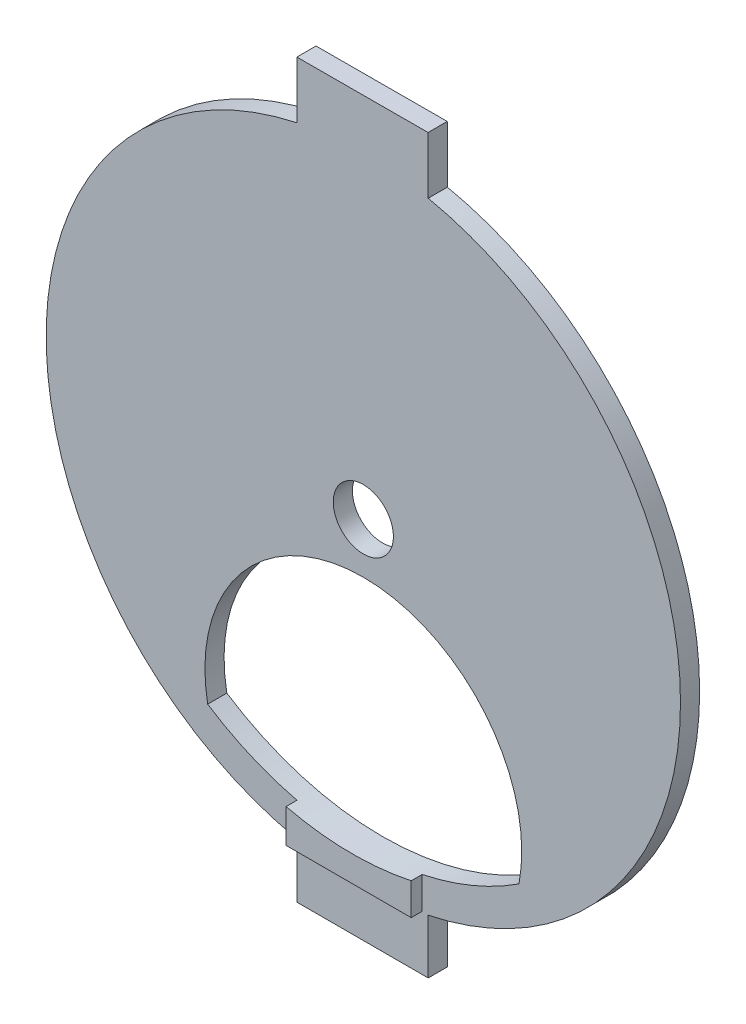
from build123d import *

# Parameters (mm, degrees)
BOSS_EXTRUDE1_DEPTH = 11.1252
SKETCH5_R           = 17.4625
CUT_EXTRUDE1_DEPTH  = 12.7
CUT_EXTRUDE4_DEPTH  = 12.7
BOSS_EXTRUDE2_START = 6.35
BOSS_EXTRUDE2_DEPTH = 6.35


with BuildPart() as part:
    # Sketch1 → Boss-Extrude1 (new body)
    with BuildSketch(Plane.XY):
        with BuildLine():
            Line((-38.598020157, 213.095995412), (-38.52088234, 180.075995412))
            ThreePointArc((-38.52088234, 180.075995412), (-184.15, 0), (-38.52088234, -180.075995412))
            Line((-38.52088234, -180.075995412), (-38.52088234, -211.825995412))
            Line((-38.52088234, -211.825995412), (37.67911766, -211.825995412))
            Line((37.67911766, -211.825995412), (37.67911766, -180.254005759))
            ThreePointArc((37.67911766, -180.254005759), (184.15, 0), (37.67911766, 180.254005759))
            Line((37.67911766, 180.254005759), (37.601979843, 213.274005759))
            Line((37.601979843, 213.274005759), (-38.598020157, 213.095995412))
        make_face()
    extrude(amount=BOSS_EXTRUDE1_DEPTH)

    # Sketch5 → Cut-Extrude1 (cut)
    with BuildSketch(Plane.XY.offset(11.1252)):
        Circle(SKETCH5_R)
    extrude(amount=-CUT_EXTRUDE1_DEPTH, mode=Mode.SUBTRACT)

    # Sketch6 → Cut-Extrude4 (cut)
    with BuildSketch(Plane.XY.offset(11.1252)):
        with BuildLine():
            ThreePointArc((90.375326038, -138.167689579), (0, -29.126312042), (-90.375326038, -138.167689579))
            ThreePointArc((-90.375326038, -138.167689579), (0, -165.1), (90.375326038, -138.167689579))
        make_face()
    extrude(amount=-CUT_EXTRUDE4_DEPTH, mode=Mode.SUBTRACT)

    # Sketch7 → Boss-Extrude2 (add)
    with BuildSketch(Plane.XY.offset(11.1252).offset(BOSS_EXTRUDE2_START)):
        with BuildLine():
            Line((-38.52088234, -160.543301398), (-38.52088234, -180.075995412))
            Line((-38.52088234, -180.075995412), (34.149976763, -180.075995412))
            Line((34.149976763, -180.075995412), (34.149976763, -161.529530078))
            ThreePointArc((34.149976763, -161.529530078), (-2.240394082, -165.084798314), (-38.52088234, -160.543301398))
        make_face()
    extrude(amount=-BOSS_EXTRUDE2_DEPTH)


solid = part.part
